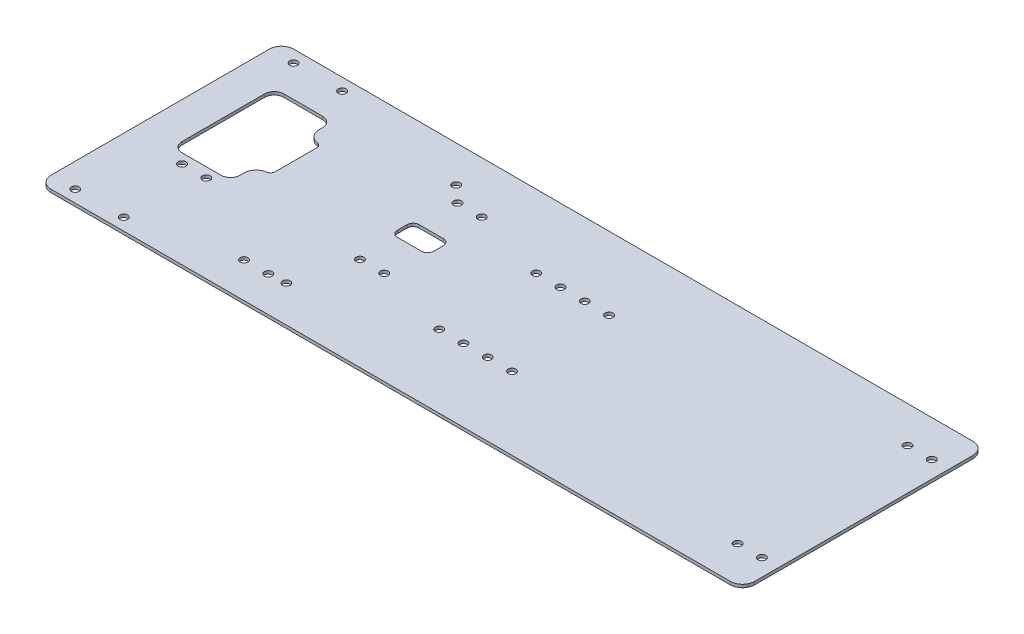
from build123d import *

# Parameters (mm, degrees)
SKETCH1_W               = 368.3
SKETCH1_H               = 127
SKETCH1_R               = 2.032
BOSS_EXTRUDE1_DEPTH     = 1.5875
FILLET1_R               = 5.08
FILLET3_R               = 6.35
FILLET4_R               = 2.54
FILLET5_R               = 6.35
SKETCH3_R               = 2.032
CUT_EXTRUDE5_DEPTH      = 195.797311855
CUT_EXTRUDE6_DEPTH      = 195.797311855
CUT_EXTRUDE6_DEPTH_BACK = 195.797311855
SKETCH4_R               = 2.032
CUT_EXTRUDE7_DEPTH      = 195.797311855
CUT_EXTRUDE7_DEPTH_BACK = 195.797311855


with BuildPart() as part:
    # Sketch1 → Boss-Extrude1 (new body)
    with BuildSketch(Plane(origin=(0, 0, 0), x_dir=(1, 0, 0), z_dir=(0, 1, 0))):
        Rectangle(SKETCH1_W, SKETCH1_H)
        with Locations((-171.45, -57.15)):
            Circle(SKETCH1_R, mode=Mode.SUBTRACT)
        with Locations((-146.05, -57.15)):
            Circle(SKETCH1_R, mode=Mode.SUBTRACT)
        with Locations((-95.25, -45.0215)):
            Circle(SKETCH1_R, mode=Mode.SUBTRACT)
        with Locations((-82.55, -45.0215)):
            Circle(SKETCH1_R, mode=Mode.SUBTRACT)
        with Locations((-154.94, -17.78)):
            Circle(SKETCH1_R, mode=Mode.SUBTRACT)
        with Locations((-142.24, -17.78)):
            Circle(SKETCH1_R, mode=Mode.SUBTRACT)
        Polygon((-134.62, -12.7), (-165.1, -12.7), (-165.1, 40.64), (-134.62, 40.64), (-134.62, 27.305), (-127, 27.305), (-127, 0.635), (-134.62, 0.635), align=None, mode=Mode.SUBTRACT)
        with Locations((-171.45, 57.15)):
            Circle(SKETCH1_R, mode=Mode.SUBTRACT)
        with Locations((-146.05, 57.15)):
            Circle(SKETCH1_R, mode=Mode.SUBTRACT)
    extrude(amount=BOSS_EXTRUDE1_DEPTH)

    # Fillet1
    fillet1_edges = [part.edges().sort_by_distance(p)[0] for p in [
        (-134.62, 0.79375, 12.7),
        (-165.1, 0.79375, 12.7),
        (-165.1, 0.79375, -40.64),
        (-134.62, 0.79375, -40.64),
    ]]
    fillet(fillet1_edges, radius=FILLET1_R)

    # Fillet3
    fillet3_edges = [part.edges().sort_by_distance(p)[0] for p in [
        (184.15, 0.79375, 63.5),
        (184.15, 0.79375, -63.5),
        (-184.15, 0.79375, 63.5),
        (-184.15, 0.79375, -63.5),
    ]]
    fillet(fillet3_edges, radius=FILLET3_R)

    # Fillet4
    fillet4_edges = [part.edges().sort_by_distance(p)[0] for p in [
        (-127, 0.79375, -0.635),
        (-127, 0.79375, -27.305),
    ]]
    fillet(fillet4_edges, radius=FILLET4_R)

    # Fillet5
    fillet5_edges = [part.edges().sort_by_distance(p)[0] for p in [
        (-134.62, 0.79375, -0.635),
        (-134.62, 0.79375, -27.305),
    ]]
    fillet(fillet5_edges, radius=FILLET5_R)

    # Sketch3 → Cut-Extrude5 (cut, through all)
    with BuildSketch(Plane(origin=(0, 1.5875, 0), x_dir=(1, 0, 0), z_dir=(0, 1, 0))):
        with Locations((25.4, -25.4)):
            Circle(SKETCH3_R)
        with Locations((25.4, 25.4)):
            Circle(SKETCH3_R)
        with Locations((162.56, -44.45)):
            Circle(SKETCH3_R)
        with Locations((162.56, 44.45)):
            Circle(SKETCH3_R)
        with Locations((0, -25.4)):
            Circle(SKETCH3_R)
        with Locations((12.7, -25.4)):
            Circle(SKETCH3_R)
        with Locations((0, 25.4)):
            Circle(SKETCH3_R)
        with Locations((12.7, 25.4)):
            Circle(SKETCH3_R)
        with Locations((175.26, 44.45)):
            Circle(SKETCH3_R)
        with Locations((175.26, -44.45)):
            Circle(SKETCH3_R)
        with Locations((-73.66, 44.45)):
            Circle(SKETCH3_R)
        with Locations((-73.66, -44.45)):
            Circle(SKETCH3_R)
        with Locations((-12.7, -25.4)):
            Circle(SKETCH3_R)
        with Locations((-12.7, 25.4)):
            Circle(SKETCH3_R)
    extrude(amount=-CUT_EXTRUDE5_DEPTH, mode=Mode.SUBTRACT)

    # Sketch4 → Cut-Extrude6 (cut, two sides: drawn at the far end of the back side and taken through both)
    with BuildSketch(Plane(origin=(0, 1.5875, 0), x_dir=(1, 0, 0), z_dir=(0, 1, 0)).offset(-CUT_EXTRUDE6_DEPTH_BACK)):
        with Locations((-65.136533, 36.598997136)):
            Circle(SKETCH4_R)
        with Locations((-52.436533, 36.598997136)):
            Circle(SKETCH4_R)
        with Locations((-65.136533, -14.463384864)):
            Circle(SKETCH4_R)
        with Locations((-52.436533, -14.463384864)):
            Circle(SKETCH4_R)
    extrude(amount=CUT_EXTRUDE6_DEPTH + CUT_EXTRUDE6_DEPTH_BACK, mode=Mode.SUBTRACT)

    # Sketch5 → Cut-Extrude7 (cut, two sides: drawn at the far end of the back side and taken through both)
    with BuildSketch(Plane(origin=(0, 1.5875, 0), x_dir=(1, 0, 0), z_dir=(0, 1, 0)).offset(-CUT_EXTRUDE7_DEPTH_BACK)):
        with BuildLine():
            ThreePointArc((-65.375, 16.780348954), (-67.62006403, 15.850412984), (-68.55, 13.605348954))
            Line((-68.55, 13.605348954), (-68.55, 8.525348954))
            ThreePointArc((-68.55, 8.525348954), (-67.62006403, 6.280284924), (-65.375, 5.350348954))
            Line((-65.375, 5.350348954), (-52.675, 5.332779336))
            ThreePointArc((-52.675, 5.332779336), (-50.42993597, 6.262715306), (-49.5, 8.507779336))
            Line((-49.5, 8.507779336), (-49.5, 13.587779336))
            ThreePointArc((-49.5, 13.587779336), (-50.42993597, 15.832843366), (-52.675, 16.762779336))
            Line((-52.675, 16.762779336), (-65.375, 16.780348954))
        make_face()
    extrude(amount=CUT_EXTRUDE7_DEPTH + CUT_EXTRUDE7_DEPTH_BACK, mode=Mode.SUBTRACT)


solid = part.part
